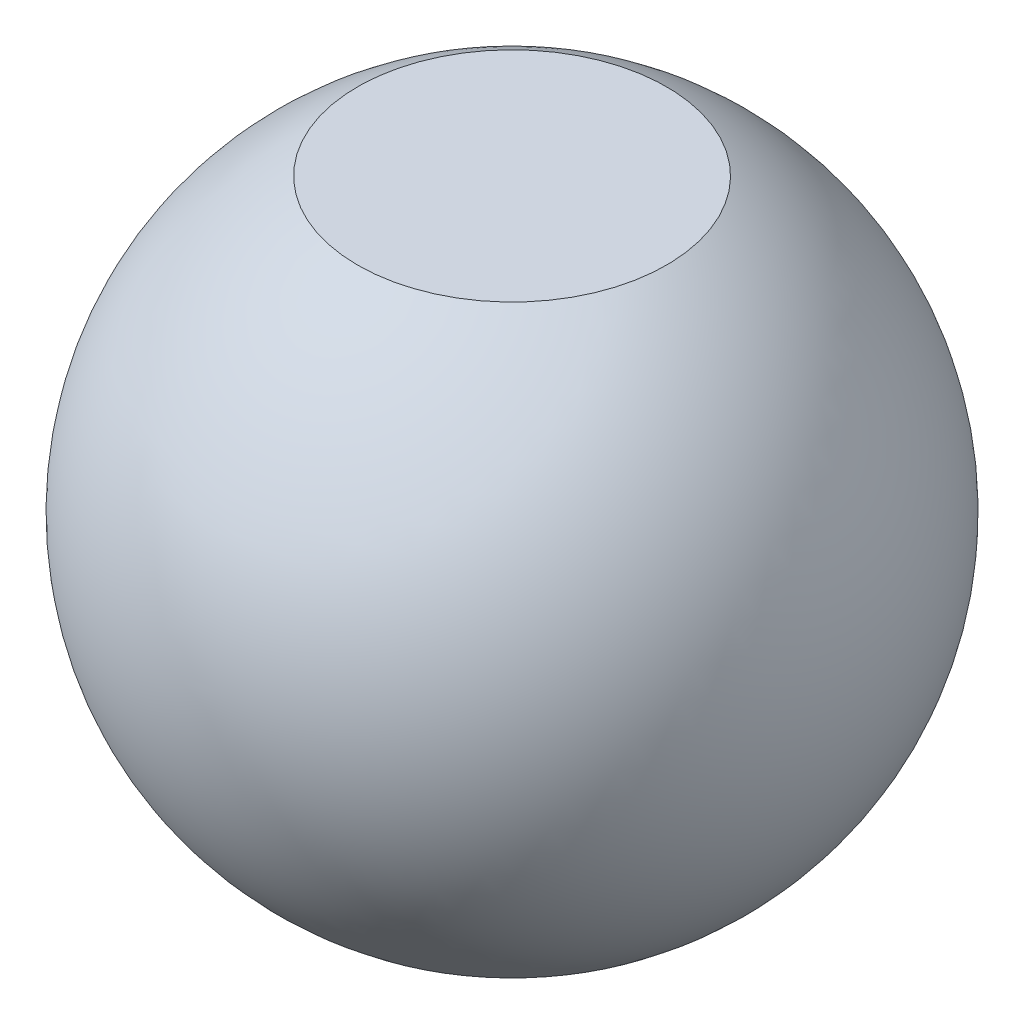
from build123d import *

# Parameters (mm, degrees)
SURFACECUT1_START     = 13.25
SURFACECUT1_OUTLINE_W = 18
SURFACECUT1_OUTLINE_H = 18
SURFACECUT1_DEPTH     = 1.75


# Read off the part's stored shape, not the designer's step: SurfaceCut1
with BuildPart() as part:
    # Sketch1 → Revolve1 (revolve)
    with BuildSketch(Plane(origin=(0, 0, 0), x_dir=(1, 0, 0), z_dir=(0, 1, 0))):
        with BuildLine():
            Line((0, 15), (0, -15))
            ThreePointArc((0, -15), (15, 0), (0, 15))
        make_face()
    revolve(axis=Axis((0, 0, -15), (0, 0, 1)))

    # SurfaceCut1 outline → SurfaceCut1 (cut)
    with BuildSketch(Plane(origin=(0, 0, 0), x_dir=(1, 0, 0), z_dir=(0, 1, 0)).offset(SURFACECUT1_START)):
        Rectangle(SURFACECUT1_OUTLINE_W, SURFACECUT1_OUTLINE_H)
    extrude(amount=SURFACECUT1_DEPTH, mode=Mode.SUBTRACT)


solid = part.part
